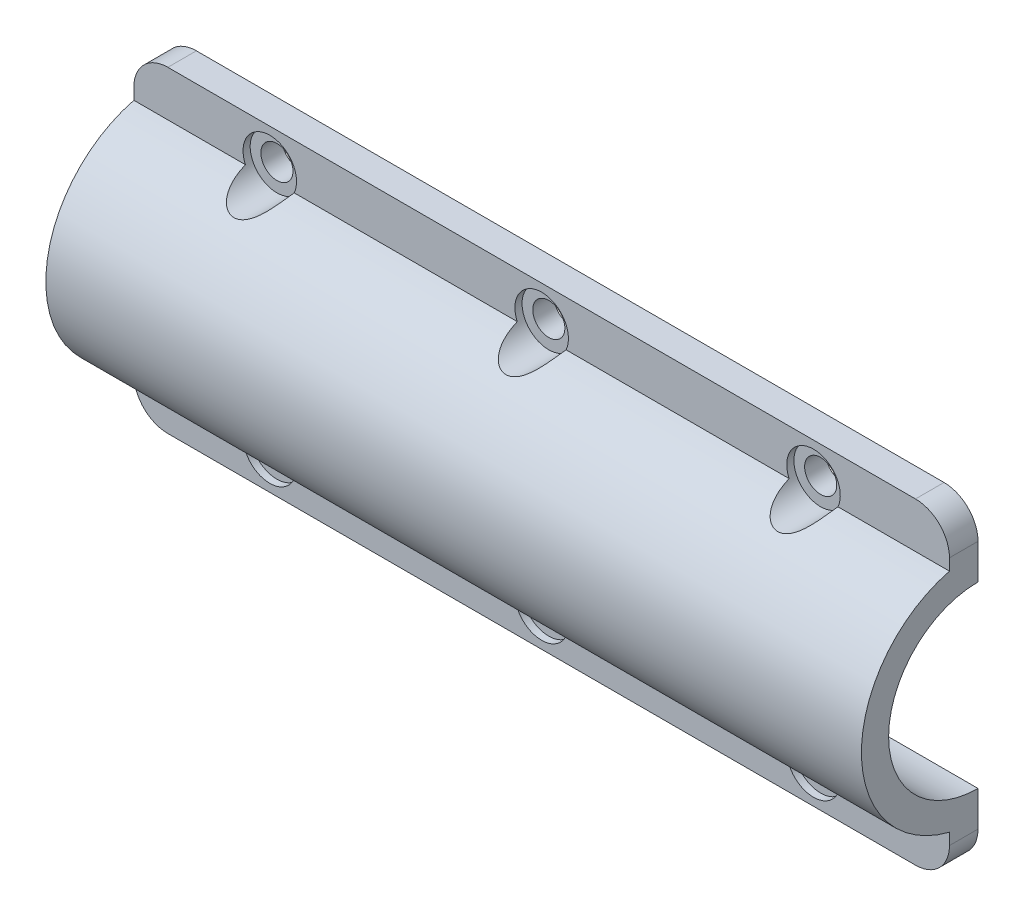
from build123d import *

# Parameters (mm, degrees)
BOSS_EXTRUDE1_DEPTH  = 114.3
CUT_EXTRUDE1_START   = -1
SKETCH2_R            = 3.75
CUT_EXTRUDE1_DEPTH   = 7.35
M4_CLEARANCE_HOLE1_D = 4.5
FILLET1_R            = 4.7625


with BuildPart() as part:
    # Sketch1 → Boss-Extrude1 (new body)
    with BuildSketch(Plane(origin=(0, 0, 0), x_dir=(0, 0, -1), z_dir=(1, 0, 0))):
        with BuildLine():
            Line((0, 22.225), (-4, 22.225))
            Line((-4, 22.225), (-4, 15.839643355))
            ThreePointArc((-4, 15.839643355), (-16.3369, 0), (-4, -15.839643355))
            Line((-4, -15.839643355), (-4, -22.225))
            Line((-4, -22.225), (0, -22.225))
            Line((0, -22.225), (0, -12.5269))
            ThreePointArc((0, -12.5269), (-12.5269, 0), (0, 12.5269))
            Line((0, 12.5269), (0, 22.225))
        make_face()
    extrude(amount=BOSS_EXTRUDE1_DEPTH)

    # Sketch2 → Cut-Extrude1 (cut)
    with BuildSketch(Plane.XY.offset(4).offset(CUT_EXTRUDE1_START)):
        with Locations((19.05, -17.37595)):
            Circle(SKETCH2_R)
        with Locations((57.15, -17.37595)):
            Circle(SKETCH2_R)
        with Locations((95.25, -17.37595)):
            Circle(SKETCH2_R)
    cut_extrude1 = extrude(amount=CUT_EXTRUDE1_DEPTH, mode=Mode.SUBTRACT)

    # M4 Clearance Hole1 (through all)
    with Locations(Plane.XY.offset(4)):
        with Locations((19.05, -17.37595), (57.15, -17.37595), (95.25, -17.37595)):
            m4_clearance_hole1 = Hole(M4_CLEARANCE_HOLE1_D / 2)

    # Mirror1: Cut-Extrude1, M4 Clearance Hole1 across plane
    add(cut_extrude1.mirror(Plane.ZX), mode=Mode.SUBTRACT)
    add(m4_clearance_hole1.mirror(Plane.ZX), mode=Mode.SUBTRACT)

    # Fillet1
    fillet1_edges = [part.edges().sort_by_distance(p)[0] for p in [
        (114.3, 22.225, 2),
        (114.3, -22.225, 2),
        (0, 22.225, 2),
        (0, -22.225, 2),
    ]]
    fillet(fillet1_edges, radius=FILLET1_R)


solid = part.part
